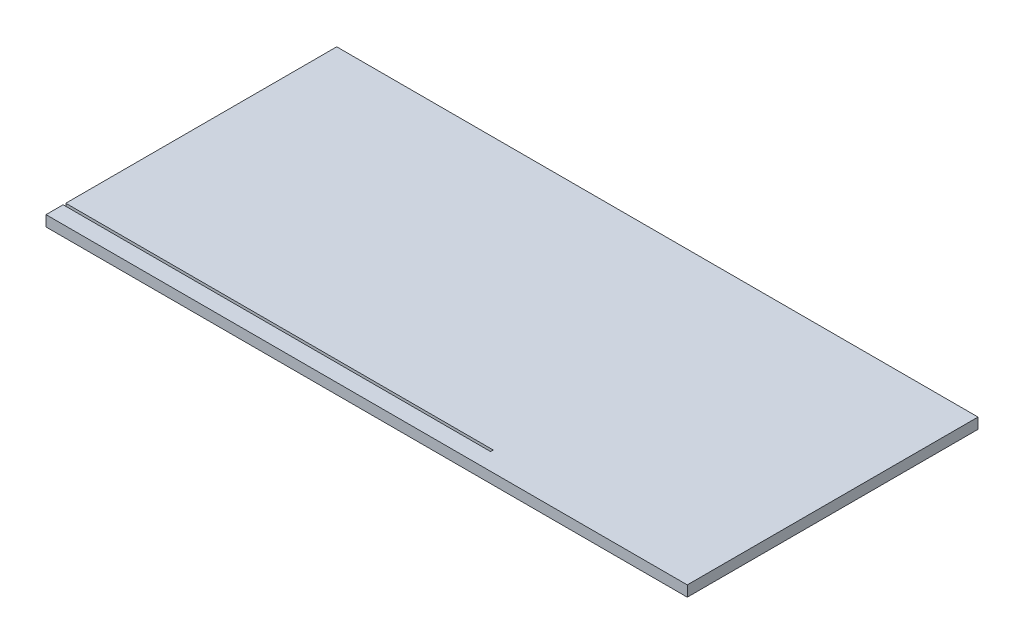
from build123d import *

# Parameters (mm, degrees)
SKETCH1_W           = 600
SKETCH1_H           = 272
BOSS_EXTRUDE1_DEPTH = 10
SKETCH2_W           = 400
SKETCH2_H           = 2.5
CUT_EXTRUDE1_DEPTH  = 2.5


with BuildPart() as part:
    # Sketch1 → Boss-Extrude1 (new body)
    with BuildSketch(Plane(origin=(0, 0, 0), x_dir=(1, 0, 0), z_dir=(0, 1, 0))):
        with Locations((300, 136)):
            Rectangle(SKETCH1_W, SKETCH1_H)
    extrude(amount=BOSS_EXTRUDE1_DEPTH)

    # Sketch2 → Cut-Extrude1 (cut)
    with BuildSketch(Plane(origin=(0, 10, 0), x_dir=(1, 0, 0), z_dir=(0, 1, 0))):
        with Locations((200, 17.25)):
            Rectangle(SKETCH2_W, SKETCH2_H)
    extrude(amount=-CUT_EXTRUDE1_DEPTH, mode=Mode.SUBTRACT)


solid = part.part
